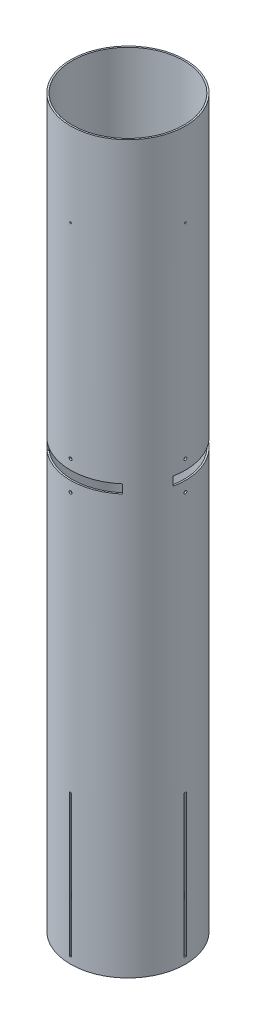
from build123d import *

# Parameters (mm, degrees)
SKETCH1_R                 = 78.359
SKETCH1_R_2               = 76.2
BOSS_EXTRUDE1_DEPTH       = 990.6
FIN_SLOTS_DEPTH           = 997.779125866
CIRPATTERN1_COUNT         = 4
CUT_EXTRUDE2_DEPTH        = 997.779125866
CIRPATTERN2_COUNT         = 4
SKETCH3_R                 = 3.175
CUT_EXTRUDE3_DEPTH        = 997.779125982
CUT_EXTRUDE4_START        = -12.065
CUT_EXTRUDE4_DEPTH        = 12.065
CIRPATTERN3_COUNT         = 3
SKETCH2_4_R               = 1.0922
SHEAR_SCREW_HOLES_DEPTH   = 997.779125982
SHEAR_SCREW_PATTERN_COUNT = 4
LPATTERN1_COUNT           = 2
LPATTERN1_PITCH           = 39.69160972
LPATTERN1_COPY_1_DEPTH    = 997.779125866
LPATTERN1_COPY_2_DEPTH    = 997.779125866
LPATTERN1_COPY_3_DEPTH    = 997.779125866


with BuildPart() as part:
    # Sketch1 → Boss-Extrude1 (new body)
    with BuildSketch(Plane(origin=(0, 0, 0), x_dir=(1, 0, 0), z_dir=(0, 1, 0))):
        Circle(SKETCH1_R)
        Circle(SKETCH1_R_2, mode=Mode.SUBTRACT)
    extrude(amount=BOSS_EXTRUDE1_DEPTH)

    # Sketch2 → Fin Slots (cut, through all)
    with BuildSketch(Plane(origin=(0, 0, 0), x_dir=(0, 0, -1), z_dir=(1, 0, 0))):
        Polygon((0, 8.89), (1.5875, 8.89), (1.5875, 203.2), (-1.5875, 203.2), (-1.5875, 8.89), align=None)
    fin_slots = extrude(amount=-FIN_SLOTS_DEPTH, mode=Mode.SUBTRACT)

    # CirPattern1: Fin Slots ×4 about axis
    cirpattern1_axis = Axis((0, 0, 0), (0, 1, 0))
    for i in range(1, CIRPATTERN1_COUNT):
        add(fin_slots.rotate(cirpattern1_axis, i * 360 / CIRPATTERN1_COUNT), mode=Mode.SUBTRACT)

    # Sketch2<3> → Cut-Extrude2 (cut, through all)
    with BuildSketch(Plane(origin=(0, 0, 0), x_dir=(0, 0, -1), z_dir=(1, 0, 0))):
        with BuildLine():
            ThreePointArc((1.999996, 597.4705094), (1.414210734, 598.884720134), (0, 599.4705054))
            ThreePointArc((0, 599.4705054), (-1.414210734, 596.056298666), (1.999996, 597.4705094))
        make_face()
    cut_extrude2 = extrude(amount=-CUT_EXTRUDE2_DEPTH, mode=Mode.SUBTRACT)

    # CirPattern2: Cut-Extrude2 ×4 about axis
    cirpattern2_axis = Axis((0, 990.6, 0), (0, -1, 0))
    for i in range(1, CIRPATTERN2_COUNT):
        add(cut_extrude2.rotate(cirpattern2_axis, i * 360 / CIRPATTERN2_COUNT), mode=Mode.SUBTRACT)

    # Sketch3 → Cut-Extrude3 (cut, through all)
    with BuildSketch(Plane(origin=(0, 0, 0), x_dir=(0.7071067811865477, 0, -0.7071067811865475), z_dir=(0.7071067811865475, 0, 0.7071067811865477))):
        with Locations((0, 127)):
            Circle(SKETCH3_R)
    extrude(amount=-CUT_EXTRUDE3_DEPTH, mode=Mode.SUBTRACT)

    # Sketch7 → Cut-Extrude4 (cut)
    with BuildSketch(Plane(origin=(0, 583.8825, 0), x_dir=(1, 0, 0), z_dir=(0, 1, 0)).offset(CUT_EXTRUDE4_START)):
        with BuildLine():
            Line((-76.853353787, -15.287082543), (-74.735838367, -14.865882538))
            ThreePointArc((-74.735838367, -14.865882538), (-65.991135768, 38.1), (-24.493687256, 72.156075868))
            Line((-24.493687256, 72.156075868), (-25.187675062, 74.200498017))
            ThreePointArc((-25.187675062, 74.200498017), (-63.106141662, 46.451563651), (-78.333472392, 1.999996))
            ThreePointArc((-78.333472392, 1.999996), (-78.359, 0), (-78.333472392, -1.999996))
            ThreePointArc((-78.333472392, -1.999996), (-77.877303639, -8.675163336), (-76.853353787, -15.287082543))
        make_face()
    cut_extrude4 = extrude(amount=CUT_EXTRUDE4_DEPTH, mode=Mode.SUBTRACT)

    # CirPattern3: Cut-Extrude4 ×3 about axis
    cirpattern3_axis = Axis((0, 990.6, 0), (0, -1, 0))
    for i in range(1, CIRPATTERN3_COUNT):
        add(cut_extrude4.rotate(cirpattern3_axis, i * 360 / CIRPATTERN3_COUNT), mode=Mode.SUBTRACT)

    # Sketch2<4> → Shear Screw Holes (cut, through all)
    with BuildSketch(Plane(origin=(0, 0, 0), x_dir=(0, 0, -1), z_dir=(1, 0, 0))):
        with Locations((0, 876.3)):
            Circle(SKETCH2_4_R)
    shear_screw_holes = extrude(amount=-SHEAR_SCREW_HOLES_DEPTH, mode=Mode.SUBTRACT)

    # Shear Screw Pattern: Shear Screw Holes ×4 about axis
    shear_screw_pattern_axis = Axis((0, 990.6, 0), (0, -1, 0))
    for i in range(1, SHEAR_SCREW_PATTERN_COUNT):
        add(shear_screw_holes.rotate(shear_screw_pattern_axis, i * 360 / SHEAR_SCREW_PATTERN_COUNT), mode=Mode.SUBTRACT)

    # LPattern1: Cut-Extrude2 ×2
    with Locations(*[(0, -i * LPATTERN1_PITCH, 0) for i in range(1, LPATTERN1_COUNT)]):
        add(cut_extrude2, mode=Mode.SUBTRACT)

    # LPattern1 copy 1 sketch → LPattern1 copy 1 (cut, through all)
    with BuildSketch(Plane(origin=(0, -39.69160972, 0), x_dir=(1, 0, 0), z_dir=(0, 0, 1))):
        with BuildLine():
            ThreePointArc((1.999996, 597.4705094), (1.414210734, 598.884720134), (0, 599.4705054))
            ThreePointArc((0, 599.4705054), (-1.414210734, 596.056298666), (1.999996, 597.4705094))
        make_face()
    extrude(amount=-LPATTERN1_COPY_1_DEPTH, mode=Mode.SUBTRACT)

    # LPattern1 copy 2 sketch → LPattern1 copy 2 (cut, through all)
    with BuildSketch(Plane(origin=(0, -39.69160972, 0), x_dir=(0, 0, 1), z_dir=(-1, 0, 0))):
        with BuildLine():
            ThreePointArc((1.999996, 597.4705094), (1.414210734, 598.884720134), (0, 599.4705054))
            ThreePointArc((0, 599.4705054), (-1.414210734, 596.056298666), (1.999996, 597.4705094))
        make_face()
    extrude(amount=-LPATTERN1_COPY_2_DEPTH, mode=Mode.SUBTRACT)

    # LPattern1 copy 3 sketch → LPattern1 copy 3 (cut, through all)
    with BuildSketch(Plane(origin=(0, -39.69160972, 0), x_dir=(-1, 0, 0), z_dir=(0, 0, -1))):
        with BuildLine():
            ThreePointArc((1.999996, 597.4705094), (1.414210734, 598.884720134), (0, 599.4705054))
            ThreePointArc((0, 599.4705054), (-1.414210734, 596.056298666), (1.999996, 597.4705094))
        make_face()
    extrude(amount=-LPATTERN1_COPY_3_DEPTH, mode=Mode.SUBTRACT)


solid = part.part
